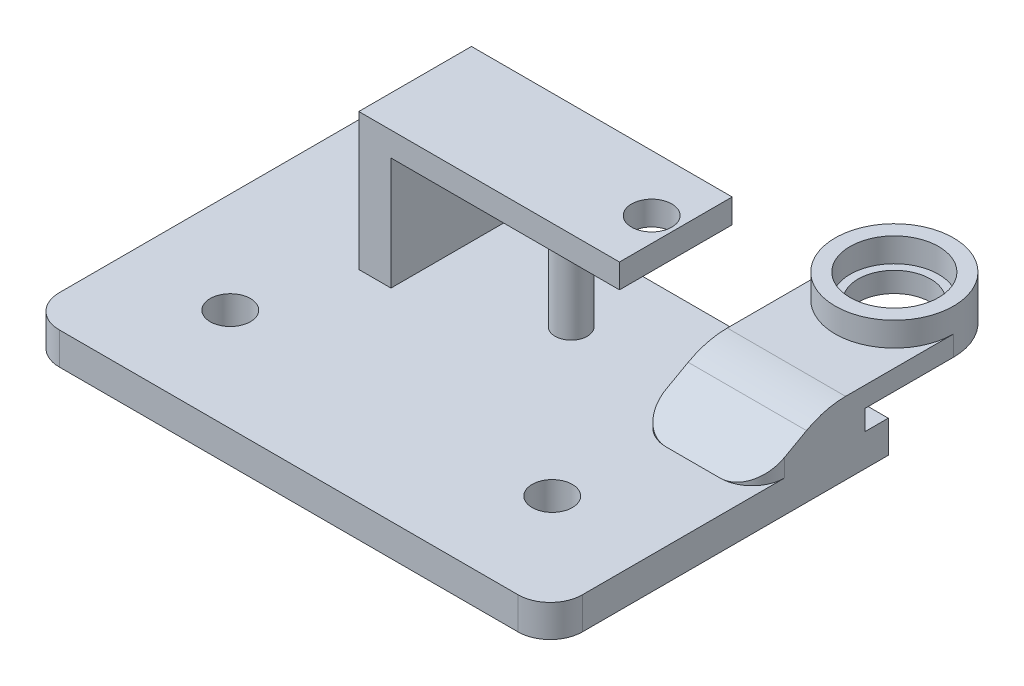
from build123d import *

# Parameters (mm, degrees)
SKETCH1_R                = 2.5
BOSS_EXTRUDE1_DEPTH      = 4
SKETCH2_R                = 2
SKETCH2_W                = 65
SKETCH2_H                = 4
BOSS_EXTRUDE2_DEPTH      = 13
BOSS_EXTRUDE3_DEPTH      = 4
SKETCH4_W                = 65
SKETCH4_H                = 4
BOSS_EXTRUDE4_DEPTH      = 20
FILLET1_R                = 4
SKETCH6_R                = 2.5
CUT_EXTRUDE1_DEPTH       = 20
SKETCH7_W                = 46
SKETCH7_H                = 4
CUT_EXTRUDE2_DEPTH       = 80
BOSS_EXTRUDE6_DEPTH      = 2.5
BOSS_EXTRUDE6_DEPTH_BACK = 2.5
CUT_EXTRUDE3_REACH       = 94.25
FILLET2_R                = 4
BOSS_EXTRUDE5_START      = 5
SKETCH8_R                = 6
SKETCH8_R_2              = 2.5
BOSS_EXTRUDE5_DEPTH      = 5
FILLET3_R                = 4
BOSS_EXTRUDE7_START      = 4
BOSS_EXTRUDE7_DEPTH      = 3.5
SKETCH13_R               = 4.5
CUT_EXTRUDE4_DEPTH       = 6
SKETCH14_W               = 13.282344927
SKETCH14_H               = 18
CUT_EXTRUDE5_DEPTH       = 6
FILLET5_R                = 4
SKETCH15_W               = 65
SKETCH15_H               = 4
BOSS_EXTRUDE8_DEPTH      = 20
SKETCH16_R               = 2.5
CUT_EXTRUDE6_DEPTH       = 30
SKETCH18_W               = 5.451877136
SKETCH18_H               = 11.015996258
BOSS_EXTRUDE9_DEPTH      = 17
CUT_EXTRUDE7_START       = -3.235556
SKETCH19_W               = 62
SKETCH19_H               = 17
CUT_EXTRUDE7_DEPTH       = 10.735556
BOSS_EXTRUDE10_START     = 5
SKETCH20_R               = 4
SKETCH20_R_2             = 2.5
BOSS_EXTRUDE10_DEPTH     = 5
SKETCH21_W               = 4
SKETCH21_H               = 14
BOSS_EXTRUDE11_DEPTH     = 17
SKETCH22_W               = 14
SKETCH22_H               = 3
BOSS_EXTRUDE12_DEPTH     = 37.388836628
CUT_EXTRUDE8_START       = 12
SKETCH24_R               = 2.5
CUT_EXTRUDE8_DEPTH       = 12
SKETCH25_W               = 11.015996258
SKETCH25_H               = 17
CUT_EXTRUDE9_DEPTH       = 5.451877136
SKETCH26_R               = 6
CUT_EXTRUDE10_DEPTH      = 5
BOSS_EXTRUDE13_START     = -4
SKETCH27_R               = 4.5
BOSS_EXTRUDE13_DEPTH     = 4
BOSS_EXTRUDE14_DEPTH     = 5
CUT_EXTRUDE11_DEPTH      = 14.7
FILLET6_R                = 10
BOSS_EXTRUDE15_START     = -2.5
SKETCH32_R               = 4
BOSS_EXTRUDE15_DEPTH     = 2.5
SKETCH28_W               = 20
SKETCH28_H               = 4
CUT_EXTRUDE12_DEPTH      = 65
SKETCH33_W               = 9
SKETCH33_H               = 14
CUT_EXTRUDE13_DEPTH      = 3
BOSS_EXTRUDE18_START     = -8.5
BOSS_EXTRUDE18_DEPTH     = 3
SKETCH35_R               = 2
BOSS_EXTRUDE19_DEPTH     = 17
SKETCH37_R               = 7.35
SKETCH37_R_2             = 5.5
BOSS_EXTRUDE20_DEPTH     = 3
SKETCH38_R               = 4.5
CUT_EXTRUDE14_DEPTH      = 3


with BuildPart() as part:
    # Sketch1 → Boss-Extrude1 (new body)
    with BuildSketch(Plane(origin=(0, 0, 0), x_dir=(1, 0, 0), z_dir=(0, 1, 0))):
        with BuildLine():
            Line((4, 0), (61, 0))
            ThreePointArc((61, 0), (63.828427125, 1.171572875), (65, 4))
            Line((65, 4), (65, 42))
            Line((65, 42), (0, 42))
            Line((0, 42), (0, 4))
            ThreePointArc((0, 4), (1.171572875, 1.171572875), (4, 0))
        make_face()
        with Locations(Location((12.5, 12.75, 0), (0, 0, 270))):
            Circle(SKETCH1_R, mode=Mode.SUBTRACT)
        with Locations(Location((52.5, 12.75, 0), (0, 0, 270))):
            Circle(SKETCH1_R, mode=Mode.SUBTRACT)
    extrude(amount=BOSS_EXTRUDE1_DEPTH)

    # Sketch2 → Boss-Extrude2 (add)
    with BuildSketch(Plane(origin=(0, 4, 0), x_dir=(1, 0, 0), z_dir=(0, 1, 0))):
        with Locations(Location((61, 4, 0), (0, 0, 90))):
            Circle(SKETCH2_R)
        with Locations(Location((4, 4, 0), (0, 0, 90))):
            Circle(SKETCH2_R)
        with Locations((32.5, 40)):
            Rectangle(SKETCH2_W, SKETCH2_H)
    extrude(amount=BOSS_EXTRUDE2_DEPTH)

    # Sketch3 → Boss-Extrude3 (add)
    with BuildSketch(Plane(origin=(0, 17, 0), x_dir=(1, 0, 0), z_dir=(0, 1, 0))):
        with BuildLine():
            Line((0, 42), (65, 42))
            Line((65, 42), (65, 4))
            ThreePointArc((65, 4), (63.828427125, 1.171572875), (61, 0))
            Line((61, 0), (4, 0))
            ThreePointArc((4, 0), (1.171572875, 1.171572875), (0, 4))
            Line((0, 4), (0, 42))
        make_face()
    extrude(amount=BOSS_EXTRUDE3_DEPTH)

    # Sketch4 → Boss-Extrude4 (add)
    with BuildSketch(Plane(origin=(0, 0, -42), x_dir=(-1, 0, 0), z_dir=(0, 0, -1))):
        with Locations((-32.5, 19)):
            Rectangle(SKETCH4_W, SKETCH4_H)
    extrude(amount=BOSS_EXTRUDE4_DEPTH)

    # Fillet1
    fillet1_edges = [part.edges().sort_by_distance(p)[0] for p in [
        (65, 19, -62),
        (0, 19, -62),
    ]]
    fillet(fillet1_edges, radius=FILLET1_R)

    # Sketch6 → Cut-Extrude1 (cut)
    with BuildSketch(Plane(origin=(0, 21, 0), x_dir=(1, 0, 0), z_dir=(0, 1, 0))):
        with Locations(Location((57.65, 50.10433299, 0), (0, 0, 270))):
            Circle(SKETCH6_R)
        with Locations(Location((45.5, 32.10433299, 0), (0, 0, 270))):
            Circle(SKETCH6_R)
    extrude(amount=-CUT_EXTRUDE1_DEPTH, mode=Mode.SUBTRACT)

    # Sketch7 → Cut-Extrude2 (cut)
    with BuildSketch(Plane.XY):
        Polygon((4, 17), (4, 21), (0, 21), (0, 4), (50, 4), (50, 17), align=None)
        with Locations((27, 19)):
            Rectangle(SKETCH7_W, SKETCH7_H)
    extrude(amount=-CUT_EXTRUDE2_DEPTH, mode=Mode.SUBTRACT)

    # Sketch10 → Boss-Extrude6 (add, two sides: drawn at the far end of the back side and taken through both)
    with BuildSketch(Plane(origin=(57.5, 0, 0), x_dir=(0, 0, -1), z_dir=(1, 0, 0)).offset(-BOSS_EXTRUDE6_DEPTH_BACK)):
        Polygon((33, 4), (38, 9), (38, 4), align=None)
    extrude(amount=BOSS_EXTRUDE6_DEPTH + BOSS_EXTRUDE6_DEPTH_BACK)

    # Cut-Extrude3: up to this face of the body (flat: up to its plane)
    cut_extrude3_end = Plane(part.part.faces().sort_by_distance((31.433090337, 4, -20.592914262))[0])
    # Sketch11 → Cut-Extrude3 (cut, up to the picked face)
    with BuildSketch(Plane(origin=(0, 21, 0), x_dir=(1, 0, 0), z_dir=(0, 1, 0)), mode=Mode.PRIVATE) as cut_extrude3_sk1:
        with BuildLine():
            Line((57.5, 0), (57.5, 42))
            ThreePointArc((57.5, 42), (56.914213562, 43.414213562), (55.5, 44))
            Line((55.5, 44), (50, 44))
            Line((50, 44), (50, 0))
            Line((50, 0), (57.5, 0))
        make_face()
    cut_extrude3_tool1 = split(extrude(cut_extrude3_sk1.sketch, amount=-CUT_EXTRUDE3_REACH, mode=Mode.PRIVATE), bisect_by=cut_extrude3_end, keep=Keep.BOTH, mode=Mode.PRIVATE)
    add(cut_extrude3_tool1.solids().sort_by(Axis((53.741385, 21, -21.943789), (0, -1, 0)))[0], mode=Mode.SUBTRACT)

    # Fillet2
    # the kernel refuses this fillet: 4 mm, written as the material it takes off along each edge
    with BuildSketch(Plane(origin=(57.5, 30.921567416, 0), x_dir=(1, 0, 0), z_dir=(0, -1, 0))) as fillet2_piece_1:
        with BuildLine():
            CenterArc((4, -3.968626967), FILLET2_R, 97.180755781, 82.819244219)
            Line((0, -3.968626967), (-0.08, -3.968626967))
            Line((-0.08, -3.968626967), (-0.08, 0))
            Line((-0.08, 0), (0, 0.08))
            ThreePointArc((0, 0.08), (1.75, 0.08), (3.49, 0.079372539))
            Line((3.49, 0.079372539), (3.5, 0))
        make_face()
    extrude(amount=23.843134833, mode=Mode.SUBTRACT)

    # Sketch8 → Boss-Extrude5 (add)
    with BuildSketch(Plane(origin=(0, 4, 0), x_dir=(1, 0, 0), z_dir=(0, 1, 0)).offset(BOSS_EXTRUDE5_START)):
        with Locations(Location((45.5, 32.10433299, 0), (0, 0, 270))):
            Circle(SKETCH8_R)
        with Locations(Location((45.5, 32.10433299, 0), (0, 0, 270))):
            Circle(SKETCH8_R_2, mode=Mode.SUBTRACT)
    extrude(amount=-BOSS_EXTRUDE5_DEPTH)

    # Fillet3
    fillet3_edges = [part.edges().sort_by_distance(p)[0] for p in [
        (50, 19, -62),
    ]]
    fillet(fillet3_edges, radius=FILLET3_R)

    # Sketch12 → Boss-Extrude7 (add)
    with BuildSketch(Plane(origin=(57.5, 0, 0), x_dir=(0, 0, -1), z_dir=(1, 0, 0)).offset(BOSS_EXTRUDE7_START)):
        Polygon((42, 12), (47, 17), (42, 17), align=None)
    extrude(amount=BOSS_EXTRUDE7_DEPTH)

    # Sketch13 → Cut-Extrude4 (cut)
    with BuildSketch(Plane.XZ):
        with Locations(Location((45.5, -32.10433299, 0), (0, 0, 270))):
            Circle(SKETCH13_R)
    extrude(amount=-CUT_EXTRUDE4_DEPTH, mode=Mode.SUBTRACT)

    # Sketch14 → Cut-Extrude5 (cut)
    with BuildSketch(Plane(origin=(0, 21, 0), x_dir=(1, 0, 0), z_dir=(0, 1, 0))):
        with Locations((47.623272126, 53)):
            Rectangle(SKETCH14_W, SKETCH14_H)
    extrude(amount=-CUT_EXTRUDE5_DEPTH, mode=Mode.SUBTRACT)

    # Fillet5
    fillet5_edges = [part.edges().sort_by_distance(p)[0] for p in [
        (54.264444589, 19, -62),
        (54.264444589, 19, -44),
    ]]
    fillet(fillet5_edges, radius=FILLET5_R)

    # Sketch15 → Boss-Extrude8 (add)
    with BuildSketch(Plane(origin=(0, 0, -42), x_dir=(-1, 0, 0), z_dir=(0, 0, -1))):
        with Locations((-32.5, 2)):
            Rectangle(SKETCH15_W, SKETCH15_H)
    extrude(amount=BOSS_EXTRUDE8_DEPTH)

    # Sketch16 → Cut-Extrude6 (cut)
    with BuildSketch(Plane(origin=(0, 21, 0), x_dir=(1, 0, 0), z_dir=(0, 1, 0))):
        with Locations(Location((57.65, 50.10433299, 0), (0, 0, 270))):
            Circle(SKETCH16_R)
    extrude(amount=-CUT_EXTRUDE6_DEPTH, mode=Mode.SUBTRACT)

    # Sketch18 → Boss-Extrude9 (add)
    with BuildSketch(Plane(origin=(0, 4, 0), x_dir=(1, 0, 0), z_dir=(0, 1, 0))):
        with Locations((32.967615748, 5.507998129)):
            Rectangle(SKETCH18_W, SKETCH18_H)
    extrude(amount=BOSS_EXTRUDE9_DEPTH)

    # Sketch19 → Cut-Extrude7 (cut)
    with BuildSketch(Plane(origin=(57.5, 0, 0), x_dir=(0, 0, -1), z_dir=(1, 0, 0)).offset(CUT_EXTRUDE7_START)):
        with Locations((31, 12.5)):
            Rectangle(SKETCH19_W, SKETCH19_H)
    extrude(amount=CUT_EXTRUDE7_DEPTH, mode=Mode.SUBTRACT)

    # Sketch20 → Boss-Extrude10 (add)
    with BuildSketch(Plane(origin=(0, 4, 0), x_dir=(1, 0, 0), z_dir=(0, 1, 0)).offset(BOSS_EXTRUDE10_START)):
        with Locations(Location((57.65, 50.10433299, 0), (0, 0, 270))):
            Circle(SKETCH20_R)
        with Locations(Location((57.65, 50.10433299, 0), (0, 0, 270))):
            Circle(SKETCH20_R_2, mode=Mode.SUBTRACT)
    extrude(amount=-BOSS_EXTRUDE10_DEPTH)

    # Sketch21 → Boss-Extrude11 (add)
    with BuildSketch(Plane(origin=(0, 4, 0), x_dir=(1, 0, 0), z_dir=(0, 1, 0))):
        with Locations((18.111163372, 32.10433299)):
            Rectangle(SKETCH21_W, SKETCH21_H)
    extrude(amount=BOSS_EXTRUDE11_DEPTH)

    # Sketch22 → Boss-Extrude12 (add)
    with BuildSketch(Plane(origin=(20.111163372, 0, 0), x_dir=(0, 0, -1), z_dir=(1, 0, 0))):
        with Locations((32.10433299, 19.5)):
            Rectangle(SKETCH22_W, SKETCH22_H)
    extrude(amount=BOSS_EXTRUDE12_DEPTH)

    # Sketch24 → Cut-Extrude8 (cut)
    with BuildSketch(Plane(origin=(0, 9, 0), x_dir=(1, 0, 0), z_dir=(0, 1, 0)).offset(CUT_EXTRUDE8_START)):
        with Locations(Location((45.5, 32.10433299, 0), (0, 0, 270))):
            Circle(SKETCH24_R)
    extrude(amount=-CUT_EXTRUDE8_DEPTH, mode=Mode.SUBTRACT)

    # Sketch25 → Cut-Extrude9 (cut)
    with BuildSketch(Plane(origin=(35.693554316, 0, 0), x_dir=(0, 0, -1), z_dir=(1, 0, 0))):
        with Locations((5.507998129, 12.5)):
            Rectangle(SKETCH25_W, SKETCH25_H)
    extrude(amount=-CUT_EXTRUDE9_DEPTH, mode=Mode.SUBTRACT)

    # Sketch26 → Cut-Extrude10 (cut)
    with BuildSketch(Plane(origin=(0, 9, 0), x_dir=(1, 0, 0), z_dir=(0, 1, 0))):
        with Locations((45.5, 32.10433299)):
            Circle(SKETCH26_R)
    extrude(amount=-CUT_EXTRUDE10_DEPTH, mode=Mode.SUBTRACT)

    # Sketch27 → Boss-Extrude13 (add)
    with BuildSketch(Plane(origin=(0, 4, 0), x_dir=(1, 0, 0), z_dir=(0, 1, 0)).offset(BOSS_EXTRUDE13_START)):
        with Locations((45.5, 32.10433299)):
            Circle(SKETCH27_R)
    extrude(amount=BOSS_EXTRUDE13_DEPTH)

    # Sketch29 → Boss-Extrude14 (add)
    with BuildSketch(Plane(origin=(0, 4, 0), x_dir=(1, 0, 0), z_dir=(0, 1, 0))):
        with BuildLine():
            Line((61, 25.10433299), (54.3, 25.10433299))
            ThreePointArc((54.3, 25.10433299), (51.471572875, 26.275905866), (50.3, 29.10433299))
            Line((50.3, 29.10433299), (50.3, 39.10433299))
            Line((50.3, 39.10433299), (65, 39.10433299))
            Line((65, 39.10433299), (65, 29.10433299))
            ThreePointArc((65, 29.10433299), (63.828427125, 26.275905866), (61, 25.10433299))
        make_face()
    extrude(amount=BOSS_EXTRUDE14_DEPTH)

    # Sketch31 → Cut-Extrude11 (cut)
    with BuildSketch(Plane(origin=(65, 0, 0), x_dir=(0, 0, -1), z_dir=(1, 0, 0))):
        Polygon((25.10433299, 9), (25.10433299, 4), (29.10433299, 6.222222222), (29.10433299, 9), align=None)
        Polygon((29.10433299, 9), (29.10433299, 6.222222222), (34.10433299, 9), align=None)
    extrude(amount=-CUT_EXTRUDE11_DEPTH, mode=Mode.SUBTRACT)

    # Fillet6
    fillet6_edges = [part.edges().sort_by_distance(p)[0] for p in [
        (57.65, 9, -34.10433299),
    ]]
    fillet(fillet6_edges, radius=FILLET6_R)

    # Sketch32 → Boss-Extrude15 (add)
    with BuildSketch(Plane(origin=(0, 9, 0), x_dir=(1, 0, 0), z_dir=(0, 1, 0)).offset(BOSS_EXTRUDE15_START)):
        with BuildLine():
            Line((65, 39.10433299), (65, 50.10433299))
            ThreePointArc((65, 50.10433299), (57.65, 57.45433299), (50.3, 50.10433299))
            Line((50.3, 50.10433299), (50.3, 39.10433299))
            Line((50.3, 39.10433299), (65, 39.10433299))
        make_face()
        with Locations(Location((57.65, 50.10433299, 0), (0, 0, 270))):
            Circle(SKETCH32_R, mode=Mode.SUBTRACT)
    extrude(amount=BOSS_EXTRUDE15_DEPTH)

    # Sketch28 → Cut-Extrude12 (cut)
    with BuildSketch(Plane(origin=(65, 0, 0), x_dir=(0, 0, -1), z_dir=(1, 0, 0))):
        Polygon((42, 4), (62, 4), (62, 6.5), (50.10433299, 6.5), (42, 6.5), align=None)
        with Locations((52, 2)):
            Rectangle(SKETCH28_W, SKETCH28_H)
    extrude(amount=-CUT_EXTRUDE12_DEPTH, mode=Mode.SUBTRACT)

    # Sketch33 → Cut-Extrude13 (cut)
    with BuildSketch(Plane(origin=(0, 21, 0), x_dir=(1, 0, 0), z_dir=(0, 1, 0))):
        with Locations((53, 32.10433299)):
            Rectangle(SKETCH33_W, SKETCH33_H)
    extrude(amount=-CUT_EXTRUDE13_DEPTH, mode=Mode.SUBTRACT)

    # Sketch34 → Boss-Extrude18 (add)
    with BuildSketch(Plane.XY.offset(-25.10433299).offset(BOSS_EXTRUDE18_START)):
        Polygon((20.111163372, 14), (24.111163372, 18), (20.111163372, 18), align=None)
    extrude(amount=BOSS_EXTRUDE18_DEPTH)

    # Sketch35 → Boss-Extrude19 (add)
    with BuildSketch(Plane(origin=(0, 21, 0), x_dir=(1, 0, 0), z_dir=(0, 1, 0))):
        with Locations(Location((35.5, 32.10433299, 0), (0, 0, 270))):
            Circle(SKETCH35_R)
    extrude(amount=-BOSS_EXTRUDE19_DEPTH)

    # Sketch37 → Boss-Extrude20 (add)
    with BuildSketch(Plane(origin=(0, 9, 0), x_dir=(1, 0, 0), z_dir=(0, 1, 0))):
        with Locations(Location((57.65, 50.10433299, 0), (0, 0, 270))):
            Circle(SKETCH37_R)
        with Locations(Location((57.65, 50.10433299, 0), (0, 0, 270))):
            Circle(SKETCH37_R_2, mode=Mode.SUBTRACT)
    extrude(amount=BOSS_EXTRUDE20_DEPTH)

    # Sketch38 → Cut-Extrude14 (cut)
    with BuildSketch(Plane.XZ.offset(-6.5)):
        with Locations(Location((57.65, -50.10433299, 0), (0, 0, 270))):
            Circle(SKETCH38_R)
    extrude(amount=-CUT_EXTRUDE14_DEPTH, mode=Mode.SUBTRACT)


solid = part.part
